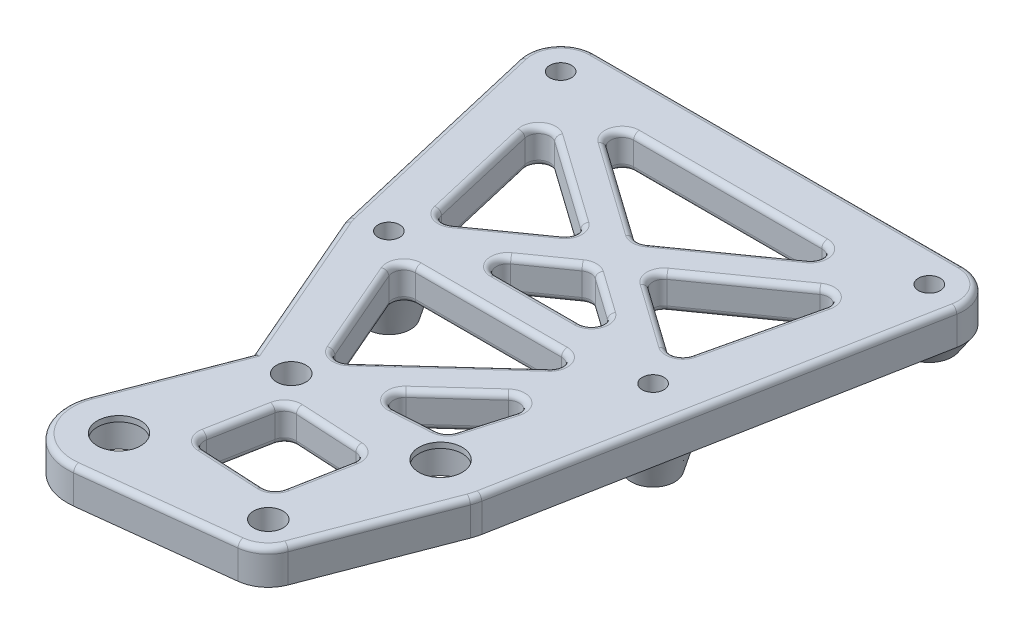
from build123d import *
from OCP.BRepFilletAPI import BRepFilletAPI_MakeChamfer

# Parameters (mm, degrees)
SKETCH1_R           = 4.05
SKETCH1_R_2         = 2.032
BOSS_EXTRUDE1_DEPTH = 4.7625
BOSS_EXTRUDE2_START = -0.7625
SKETCH2_R           = 4.05
SKETCH2_R_2         = 3
BOSS_EXTRUDE2_DEPTH = 0.7625
BOSS_EXTRUDE3_START = -4.7625
SKETCH3_R           = 1.5
BOSS_EXTRUDE3_DEPTH = 4.7625
CUT_EXTRUDE1_DEPTH  = 90.674607785
BOSS_EXTRUDE4_START = 5.5245
SKETCH5_R           = 3
SKETCH5_R_2         = 1.5
BOSS_EXTRUDE4_DEPTH = 5.5245
CHAMFER1_SIZE       = 1.5875
CHAMFER1_SIZE_2     = 5.5245
BOSS_EXTRUDE5_START = 2.3495
SKETCH6_R           = 3.175
SKETCH6_R_2         = 1.5
BOSS_EXTRUDE5_DEPTH = 2.3495
CHAMFER2_SIZE       = 1.5875
CHAMFER2_SIZE_2     = 2.3495
FILLET1_R           = 0.79375


with BuildPart() as part:
    # Sketch1 → Boss-Extrude1 (new body)
    with BuildSketch(Plane(origin=(0, 0, 0), x_dir=(1, 0, 0), z_dir=(0, 1, 0))):
        with BuildLine():
            Line((0.31636852, 20.75684537), (-6.669197219, 2.560268055))
            ThreePointArc((-6.669197219, 2.560268055), (-5.643741686, -4.37965111), (0.824278846, -7.096036108))
            Line((0.824278846, -7.096036108), (21.187019231, -4.730690739))
            ThreePointArc((21.187019231, -4.730690739), (23.557267407, -3.762494457), (25.08363148, -1.70684537))
            Line((25.08363148, -1.70684537), (32.069197219, 16.489731945))
            ThreePointArc((32.069197219, 16.489731945), (31.043741686, 23.42965111), (24.575721154, 26.146036108))
            Line((24.575721154, 26.146036108), (4.212980769, 23.780690739))
            ThreePointArc((4.212980769, 23.780690739), (1.842732593, 22.812494457), (0.31636852, 20.75684537))
        make_face()
        with Locations(Location((0, 0, 0), (0, 0, 90))):
            Circle(SKETCH1_R, mode=Mode.SUBTRACT)
        with Locations(Location((25.4, 19.05, 0), (0, 0, 90))):
            Circle(SKETCH1_R, mode=Mode.SUBTRACT)
        with Locations(Location((20.6375, 0, 0), (0, 0, 90))):
            Circle(SKETCH1_R_2, mode=Mode.SUBTRACT)
        with Locations(Location((4.7625, 19.05, 0), (0, 0, 90))):
            Circle(SKETCH1_R_2, mode=Mode.SUBTRACT)
        with BuildLine():
            Line((7.527921513, 4.190425609), (16.202386897, 3.731925143))
            ThreePointArc((16.202386897, 3.731925143), (17.266640314, 4.068672028), (17.846127168, 5.022731138))
            Line((17.846127168, 5.022731138), (19.348233823, 12.97980626))
            ThreePointArc((19.348233823, 12.97980626), (19.036826198, 14.254748277), (17.872078487, 14.859574391))
            Line((17.872078487, 14.859574391), (9.197613103, 15.318074857))
            ThreePointArc((9.197613103, 15.318074857), (8.133359686, 14.981327972), (7.553872832, 14.027268862))
            Line((7.553872832, 14.027268862), (6.051766177, 6.07019374))
            ThreePointArc((6.051766177, 6.07019374), (6.363173802, 4.795251723), (7.527921513, 4.190425609))
        make_face(mode=Mode.SUBTRACT)
    extrude(amount=BOSS_EXTRUDE1_DEPTH)

    # Sketch2 → Boss-Extrude2 (add)
    # profile 1 of 2: a face of its own
    with BuildSketch(Plane(origin=(0, 4.7625, 0), x_dir=(1, 0, 0), z_dir=(0, 1, 0)).offset(BOSS_EXTRUDE2_START)):
        with Locations(Location((25.4, 19.05, 0), (0, 0, 90))):
            Circle(SKETCH2_R)
        with Locations(Location((25.4, 19.05, 0), (0, 0, 270))):
            Circle(SKETCH2_R_2, mode=Mode.SUBTRACT)
    # profile 2 of 2: a face of its own
    with BuildSketch(Plane(origin=(0, 4.7625, 0), x_dir=(1, 0, 0), z_dir=(0, 1, 0)).offset(BOSS_EXTRUDE2_START)):
        with Locations(Location((0, 0, 0), (0, 0, 90))):
            Circle(SKETCH2_R)
        with Locations(Location((0, 0, 0), (0, 0, 270))):
            Circle(SKETCH2_R_2, mode=Mode.SUBTRACT)
    extrude(amount=BOSS_EXTRUDE2_DEPTH)

    # Sketch3 → Boss-Extrude3 (add)
    with BuildSketch(Plane(origin=(0, 4.7625, 0), x_dir=(1, 0, 0), z_dir=(0, 1, 0)).offset(BOSS_EXTRUDE3_START)):
        with BuildLine():
            Line((-12.77747, 78.58125), (38.17747, 78.58125))
            ThreePointArc((38.17747, 78.58125), (41.844532798, 76.857509071), (42.857079591, 72.934069082))
            Line((42.857079591, 72.934069082), (32.419414386, 17.722978623))
            ThreePointArc((32.419414386, 17.722978623), (30.627992008, 23.918394358), (24.575721154, 26.146036108))
            Line((24.575721154, 26.146036108), (4.212980769, 23.780690739))
            ThreePointArc((4.212980769, 23.780690739), (1.842732593, 22.812494457), (0.31636852, 20.75684537))
            Line((0.31636852, 20.75684537), (-0.380707209, 18.941045064))
            Line((-0.380707209, 18.941045064), (-9.926108666, 40.968894578))
            ThreePointArc((-9.926108666, 40.968894578), (-10.078418748, 41.368714183), (-10.194231912, 41.780589635))
            Line((-10.194231912, 41.780589635), (-17.415451912, 72.736839635))
            ThreePointArc((-17.415451912, 72.736839635), (-16.50801985, 76.779223622), (-12.77747, 78.58125))
        make_face()
        with Locations(Location((30.95625, 42.8625, 0), (0, 0, 270))):
            Circle(SKETCH3_R, mode=Mode.SUBTRACT)
        with Locations(Location((-5.55625, 42.8625, 0), (0, 0, 270))):
            Circle(SKETCH3_R, mode=Mode.SUBTRACT)
        with Locations(Location((-12.77747, 73.81875, 0), (0, 0, 270))):
            Circle(SKETCH3_R, mode=Mode.SUBTRACT)
        with Locations(Location((38.17747, 73.81875, 0), (0, 0, 270))):
            Circle(SKETCH3_R, mode=Mode.SUBTRACT)
    extrude(amount=BOSS_EXTRUDE3_DEPTH)

    # Sketch4 → Cut-Extrude1 (cut, through all)
    with BuildSketch(Plane(origin=(0, 4.7625, 0), x_dir=(1, 0, 0), z_dir=(0, 1, 0))):
        with BuildLine():
            Line((7.265954027, 24.544033316), (21.758522026, 37.719095133))
            ThreePointArc((21.758522026, 37.719095133), (22.171349892, 39.466197224), (20.690653966, 40.48125))
            Line((20.690653966, 40.48125), (0.488892512, 40.48125))
            ThreePointArc((0.488892512, 40.48125), (-0.838169867, 39.764991465), (-0.967727043, 38.262548193))
            Line((-0.967727043, 38.262548193), (4.741466412, 25.087486375))
            ThreePointArc((4.741466412, 25.087486375), (5.863994306, 24.166741337), (7.265954027, 24.544033316))
        make_face()
        with BuildLine():
            Line((14.738460036, 24.900888559), (22.166906001, 31.654021255))
            ThreePointArc((22.166906001, 31.654021255), (24.074740214, 31.826442152), (24.759512766, 30.037406964))
            Line((24.759512766, 30.037406964), (22.904381965, 23.63729514))
            ThreePointArc((22.904381965, 23.63729514), (22.372860572, 22.840837986), (21.479996417, 22.494929631))
            Line((21.479996417, 22.494929631), (15.906681253, 22.14190876))
            ThreePointArc((15.906681253, 22.14190876), (14.34447528, 23.107248561), (14.738460036, 24.900888559))
        make_face()
        with BuildLine():
            Line((6.747808448, 57.080652973), (-5.620427562, 65.835321133))
            ThreePointArc((-5.620427562, 65.835321133), (-7.423462793, 65.856924698), (-8.083593882, 64.178940877))
            Line((-8.083593882, 64.178940877), (-4.577996456, 49.150988495))
            ThreePointArc((-4.577996456, 49.150988495), (-3.595438625, 48.027477054), (-2.114830137, 48.215881816))
            Line((-2.114830137, 48.215881816), (6.747808448, 54.489166039))
            ThreePointArc((6.747808448, 54.489166039), (7.418136099, 55.784909506), (6.747808448, 57.080652973))
        make_face()
        with BuildLine():
            Line((-0.301218919, 71.4375), (25.701218919, 71.4375))
            ThreePointArc((25.701218919, 71.4375), (27.214022443, 70.331229413), (26.618391268, 68.554256533))
            Line((26.618391268, 68.554256533), (13.617172349, 59.351541027))
            ThreePointArc((13.617172349, 59.351541027), (12.7, 59.059784494), (11.782827651, 59.351541027))
            Line((11.782827651, 59.351541027), (-1.218391268, 68.554256533))
            ThreePointArc((-1.218391268, 68.554256533), (-1.814022443, 70.331229413), (-0.301218919, 71.4375))
        make_face()
        with BuildLine():
            Line((6.002828732, 48.126993467), (11.782827651, 52.218277985))
            ThreePointArc((11.782827651, 52.218277985), (12.7, 52.510034518), (13.617172349, 52.218277985))
            Line((13.617172349, 52.218277985), (19.397171268, 48.126993467))
            ThreePointArc((19.397171268, 48.126993467), (19.992802443, 46.350020587), (18.479998919, 45.24375))
            Line((18.479998919, 45.24375), (6.920001081, 45.24375))
            ThreePointArc((6.920001081, 45.24375), (5.407197557, 46.350020587), (6.002828732, 48.126993467))
        make_face()
        with BuildLine():
            Line((18.652191552, 57.080652973), (31.020427562, 65.835321133))
            ThreePointArc((31.020427562, 65.835321133), (32.823462793, 65.856924698), (33.483593882, 64.178940877))
            Line((33.483593882, 64.178940877), (29.977996456, 49.150988495))
            ThreePointArc((29.977996456, 49.150988495), (28.995438625, 48.027477054), (27.514830137, 48.215881816))
            Line((27.514830137, 48.215881816), (18.652191552, 54.489166039))
            ThreePointArc((18.652191552, 54.489166039), (17.981863901, 55.784909506), (18.652191552, 57.080652973))
        make_face()
    extrude(amount=-CUT_EXTRUDE1_DEPTH, mode=Mode.SUBTRACT)

    # Sketch5 → Boss-Extrude4 (add)
    # profile 1 of 2: a face of its own
    with BuildSketch(Plane.XZ.offset(BOSS_EXTRUDE4_START)):
        with Locations(Location((-5.55625, -42.8625, 0), (0, 0, 90))):
            Circle(SKETCH5_R)
        with Locations(Location((-5.55625, -42.8625, 0), (0, 0, 90))):
            Circle(SKETCH5_R_2, mode=Mode.SUBTRACT)
    # profile 2 of 2: a face of its own
    with BuildSketch(Plane.XZ.offset(BOSS_EXTRUDE4_START)):
        with Locations(Location((30.95625, -42.8625, 0), (0, 0, 90))):
            Circle(SKETCH5_R)
        with Locations(Location((30.95625, -42.8625, 0), (0, 0, 90))):
            Circle(SKETCH5_R_2, mode=Mode.SUBTRACT)
    extrude(amount=-BOSS_EXTRUDE4_DEPTH)

    # Chamfer1
    chamfer1_edges_1 = [part.edges().sort_by_distance(p)[0] for p in [
        (30.95625, 0, -45.8625),
    ]]
    chamfer1_side_1 = [part.faces().sort_by_distance(p)[0] for p in [
        (30.95625, 0, -45.89425),
    ]]
    chamfer1_edges_2 = [part.edges().sort_by_distance(p)[0] for p in [
        (-5.55625, 0, -45.8625),
    ]]
    chamfer1_side_2 = [part.faces().sort_by_distance(p)[0] for p in [
        (-5.55625, 0, -45.89425),
    ]]
    chamfer1 = BRepFilletAPI_MakeChamfer(part.part.solid().wrapped)
    for e in chamfer1_edges_1:
        chamfer1.Add(CHAMFER1_SIZE - 0.0001, CHAMFER1_SIZE_2 - 0.0001, e.wrapped, chamfer1_side_1[0].wrapped)
    for e in chamfer1_edges_2:
        chamfer1.Add(CHAMFER1_SIZE - 0.0001, CHAMFER1_SIZE_2 - 0.0001, e.wrapped, chamfer1_side_2[0].wrapped)
    add(Compound.cast(chamfer1.Shape()), mode=Mode.REPLACE)  # a hair under: the kernel refuses the full size

    # Sketch6 → Boss-Extrude5 (add)
    # profile 1 of 2: a face of its own
    with BuildSketch(Plane.XZ.offset(BOSS_EXTRUDE5_START)):
        with Locations(Location((-12.77747, -73.81875, 0), (0, 0, 90))):
            Circle(SKETCH6_R)
        with Locations(Location((-12.77747, -73.81875, 0), (0, 0, 90))):
            Circle(SKETCH6_R_2, mode=Mode.SUBTRACT)
    # profile 2 of 2: a face of its own
    with BuildSketch(Plane.XZ.offset(BOSS_EXTRUDE5_START)):
        with Locations(Location((38.17747, -73.81875, 0), (0, 0, 90))):
            Circle(SKETCH6_R)
        with Locations(Location((38.17747, -73.81875, 0), (0, 0, 90))):
            Circle(SKETCH6_R_2, mode=Mode.SUBTRACT)
    extrude(amount=-BOSS_EXTRUDE5_DEPTH)

    # Chamfer2
    chamfer2_edges_1 = [part.edges().sort_by_distance(p)[0] for p in [
        (38.17747, 0, -76.99375),
    ]]
    chamfer2_side_1 = [part.faces().sort_by_distance(p)[0] for p in [
        (38.17747, 0, -77.0255),
    ]]
    chamfer2_edges_2 = [part.edges().sort_by_distance(p)[0] for p in [
        (-12.77747, 0, -76.99375),
    ]]
    chamfer2_side_2 = [part.faces().sort_by_distance(p)[0] for p in [
        (-12.77747, 0, -77.0255),
    ]]
    chamfer2 = BRepFilletAPI_MakeChamfer(part.part.solid().wrapped)
    for e in chamfer2_edges_1:
        chamfer2.Add(CHAMFER2_SIZE - 0.0001, CHAMFER2_SIZE_2 - 0.0001, e.wrapped, chamfer2_side_1[0].wrapped)
    for e in chamfer2_edges_2:
        chamfer2.Add(CHAMFER2_SIZE - 0.0001, CHAMFER2_SIZE_2 - 0.0001, e.wrapped, chamfer2_side_2[0].wrapped)
    add(Compound.cast(chamfer2.Shape()), mode=Mode.REPLACE)  # a hair under: the kernel refuses the full size

    # Fillet1
    fillet1_edges = [part.edges().sort_by_distance(p)[0] for p in [
        (-5.643741686, 4.7625, 4.37965111),
        (28.995438625, 0, -48.027477054),
        (23.083510844, 0, -51.352523928),
        (17.981863901, 0, -55.784909506),
        (24.836309557, 0, -61.457987053),
        (32.823462793, 0, -65.856924698),
        (31.730795169, 0, -56.664964686),
        (28.995438625, 4.7625, -48.027477054),
        (31.730795169, 4.7625, -56.664964686),
        (32.823462793, 4.7625, -65.856924698),
        (24.836309557, 4.7625, -61.457987053),
        (17.981863901, 4.7625, -55.784909506),
        (23.083510844, 4.7625, -51.352523928),
        (11.005649038, 4.7625, 5.913363423),
        (27.214022443, 0, -70.331229413),
        (20.117781809, 0, -63.95289878),
        (12.7, 0, -59.059784494),
        (5.282218191, 0, -63.95289878),
        (-1.814022443, 0, -70.331229413),
        (12.7, 0, -71.4375),
        (27.214022443, 4.7625, -70.331229413),
        (12.7, 4.7625, -71.4375),
        (-1.814022443, 4.7625, -70.331229413),
        (5.282218191, 4.7625, -63.95289878),
        (12.7, 4.7625, -59.059784494),
        (20.117781809, 4.7625, -63.95289878),
        (5.407197557, 0, -46.350020587),
        (8.892828191, 0, -50.172635726),
        (12.7, 0, -52.510034518),
        (16.507171809, 0, -50.172635726),
        (19.992802443, 0, -46.350020587),
        (12.7, 0, -45.24375),
        (5.407197557, 4.7625, -46.350020587),
        (12.7, 4.7625, -45.24375),
        (19.992802443, 4.7625, -46.350020587),
        (16.507171809, 4.7625, -50.172635726),
        (12.7, 4.7625, -52.510034518),
        (8.892828191, 4.7625, -50.172635726),
        (14.34447528, 0, -23.107248561),
        (18.452683018, 0, -28.277454907),
        (24.074740214, 0, -31.826442152),
        (23.831947365, 0, -26.837351052),
        (22.372860572, 0, -22.840837986),
        (18.693338835, 0, -22.318419195),
        (14.34447528, 4.7625, -23.107248561),
        (18.693338835, 4.7625, -22.318419195),
        (22.372860572, 4.7625, -22.840837986),
        (23.831947365, 4.7625, -26.837351052),
        (24.074740214, 4.7625, -31.826442152),
        (18.452683018, 4.7625, -28.277454907),
        (7.418136099, 0, -55.784909506),
        (2.316489156, 0, -51.352523928),
        (-3.595438625, 0, -48.027477054),
        (-6.330795169, 0, -56.664964686),
        (-7.423462793, 0, -65.856924698),
        (0.563690443, 0, -61.457987053),
        (7.418136099, 4.7625, -55.784909506),
        (0.563690443, 4.7625, -61.457987053),
        (-7.423462793, 4.7625, -65.856924698),
        (-6.330795169, 4.7625, -56.664964686),
        (-3.595438625, 4.7625, -48.027477054),
        (2.316489156, 4.7625, -51.352523928),
        (5.863994306, 0, -24.166741337),
        (1.886869684, 0, -31.675017284),
        (-0.838169867, 0, -39.764991465),
        (10.589773239, 0, -40.48125),
        (22.171349892, 0, -39.466197224),
        (14.512238027, 0, -31.131564225),
        (5.863994306, 4.7625, -24.166741337),
        (14.512238027, 4.7625, -31.131564225),
        (22.171349892, 4.7625, -39.466197224),
        (10.589773239, 4.7625, -40.48125),
        (-0.838169867, 4.7625, -39.764991465),
        (1.886869684, 4.7625, -31.675017284),
        (23.557267407, 4.7625, 3.762494457),
        (28.576414349, 4.7625, -7.391443288),
        (32.272026358, 4.7625, -17.098483206),
        (6.363173802, 0, -4.795251723),
        (11.865154205, 0, -3.961175376),
        (17.266640314, 0, -4.068672028),
        (18.597180496, 0, -9.001268699),
        (19.036826198, 0, -14.254748277),
        (13.534845795, 0, -15.088824624),
        (8.133359686, 0, -14.981327972),
        (6.802819504, 0, -10.048731301),
        (6.363173802, 4.7625, -4.795251723),
        (11.865154205, 4.7625, -3.961175376),
        (17.266640314, 4.7625, -4.068672028),
        (18.597180496, 4.7625, -9.001268699),
        (19.036826198, 4.7625, -14.254748277),
        (13.534845795, 4.7625, -15.088824624),
        (8.133359686, 4.7625, -14.981327972),
        (6.802819504, 4.7625, -10.048731301),
        (-3.524952214, 4.7625, -10.750656559),
        (37.638246989, 4.7625, -45.328523852),
        (41.844532798, 4.7625, -76.857509071),
        (12.7, 4.7625, -78.58125),
        (-16.50801985, 4.7625, -76.779223622),
        (-13.804841912, 4.7625, -57.258714635),
        (-10.078418748, 4.7625, -41.368714183),
        (-5.153407937, 4.7625, -29.954969821),
    ]]
    fillet(fillet1_edges, radius=FILLET1_R)


solid = part.part
